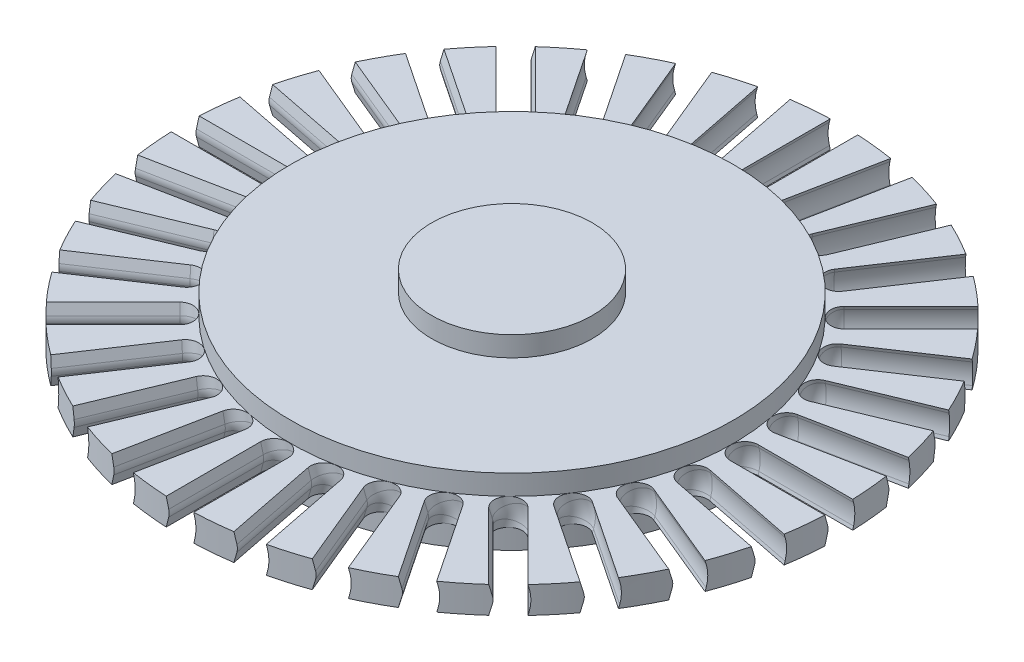
from build123d import *

# Parameters (mm, degrees)
SKETCH4_W    = 19.05
SKETCH4_H    = 25.4
SKETCH4_W_2  = 25.654
SKETCH4_H_2  = 6.35
BLADES_COUNT = 32


with BuildPart() as part:
    # Sketch4 → Disc (revolve)
    with BuildSketch(Plane.XY):
        with Locations((9.525, 0)):
            Rectangle(SKETCH4_W, SKETCH4_H)
        with Locations((65.3288, 0)):
            Rectangle(SKETCH4_W_2, SKETCH4_H_2)
        Polygon((52.5018, -7.9375), (52.5018, -3.175), (52.5018, 3.175), (52.5018, 7.9375), (19.05, 7.9375), (19.05, -7.9375), align=None)
    revolve(axis=Axis((0, 0, 0), (0, 1, 0)))

    # Blade Cutout: sweep along a path in Sketch9
    with BuildLine(Plane(origin=(78.1558, 0, 0), x_dir=(0, 0, -1), z_dir=(1, 0, 0))) as blade_cutout_path:
        Line((-3.116899243, 12.7), (-0.20784977, 1.611362948))
        ThreePointArc((-0.20784977, 1.611362948), (0, 0), (-0.20784977, -1.611362948))
        Line((-0.20784977, -1.611362948), (-3.116899243, -12.7))
    # Endmill → Blade Cutout (sweep, cut)
    with BuildSketch(Plane(origin=(0, 0, 0), x_dir=(1, 0, 0), z_dir=(0, 1, 0))):
        with BuildLine():
            Line((103.3018, 3.175), (55.6768, 3.175))
            ThreePointArc((55.6768, 3.175), (52.5018, 0), (55.6768, -3.175))
            Line((55.6768, -3.175), (103.3018, -3.175))
            Line((103.3018, -3.175), (103.3018, 3.175))
        make_face()
    blade_cutout = sweep(path=blade_cutout_path.line, mode=Mode.SUBTRACT)

    # Blades: Blade Cutout ×32 about axis
    blades_axis = Axis((0, 13.97, 0), (0, -1, 0))
    for i in range(1, BLADES_COUNT):
        add(blade_cutout.rotate(blades_axis, i * 360 / BLADES_COUNT), mode=Mode.SUBTRACT)


solid = part.part
